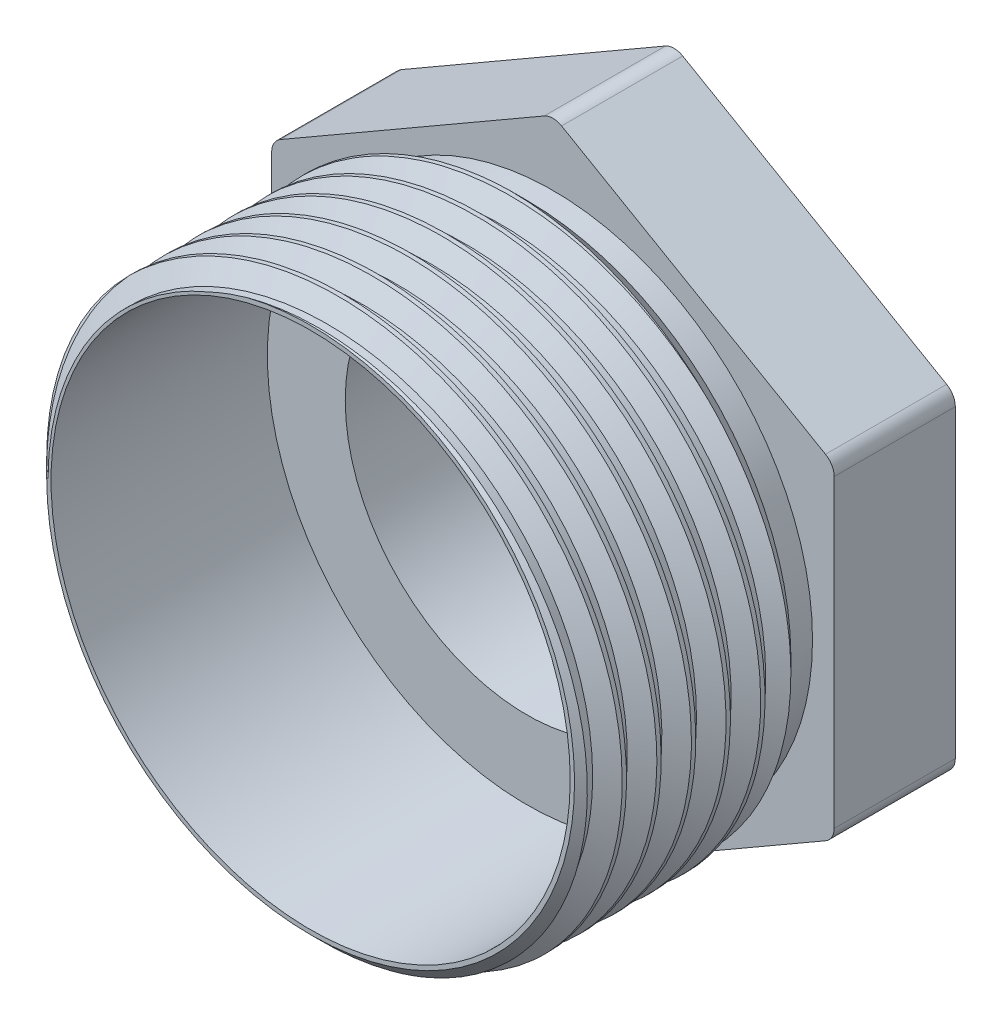
from build123d import *

# Parameters (mm, degrees)
SKETCH1_R           = 32.5
SKETCH1_R_2         = 30
SKETCH1_R_3         = 21
BOSS_EXTRUDE1_DEPTH = 14
SKETCH1_7_R         = 30
SKETCH1_7_R_2       = 21
BOSS_EXTRUDE5_DEPTH = 17
BOSS_EXTRUDE6_START = 17
SKETCH1_8_R         = 32.5
SKETCH1_8_R_2       = 30
BOSS_EXTRUDE6_DEPTH = 25
FILLET1_R           = 2
CHAMFER1_SIZE       = 2
THREAD1_PITCH       = 4


with BuildPart() as part:
    # Sketch1 → Boss-Extrude1 (new body)
    # profile 1 of 8: a face of its own
    with BuildSketch(Plane.XY):
        Circle(SKETCH1_R)
        Circle(SKETCH1_R_2, mode=Mode.SUBTRACT)
    # profile 2 of 8: a face of its own
    with BuildSketch(Plane.XY):
        Circle(SKETCH1_R_2)
        Circle(SKETCH1_R_3, mode=Mode.SUBTRACT)
    # profile 3 of 8: a face of its own
    with BuildSketch(Plane.XY):
        with BuildLine():
            ThreePointArc((16.2500004, 28.145825392), (28.145825739, 16.2499998), (32.5, 0))
            Line((32.5, 0), (32.5, 18.763883749))
            Line((32.5, 18.763883749), (16.2500004, 28.145825392))
        make_face()
    # profile 4 of 8: a face of its own
    with BuildSketch(Plane.XY):
        with BuildLine():
            Line((16.2500003, -28.14582545), (32.5, -18.763883749))
            Line((32.5, -18.763883749), (32.5, 0))
            ThreePointArc((32.5, 0), (28.14582571, -16.24999985), (16.2500003, -28.14582545))
        make_face()
    # profile 5 of 8: a face of its own
    with BuildSketch(Plane.XY):
        with BuildLine():
            ThreePointArc((-16.2500003, 28.14582545), (5.8e-08, 32.5), (16.2500004, 28.145825392))
            Line((16.2500004, 28.145825392), (0, 37.527767497))
            Line((0, 37.527767497), (-16.2500003, 28.14582545))
        make_face()
    # profile 6 of 8: a face of its own
    with BuildSketch(Plane.XY):
        with BuildLine():
            ThreePointArc((-32.5, 3e-08), (-28.145825702, 16.249999863), (-16.2500003, 28.14582545))
            Line((-16.2500003, 28.14582545), (-32.5, 18.763883749))
            Line((-32.5, 18.763883749), (-32.5, 3e-08))
        make_face()
    # profile 7 of 8: a face of its own
    with BuildSketch(Plane.XY):
        with BuildLine():
            Line((-32.5, -18.763883749), (-16.249999334, -28.145826007))
            ThreePointArc((-16.249999334, -28.145826007), (-28.145825438, -16.25000032), (-32.5, 3e-08))
            Line((-32.5, 3e-08), (-32.5, -18.763883749))
        make_face()
    # profile 8 of 8: a face of its own
    with BuildSketch(Plane.XY):
        with BuildLine():
            Line((0, -37.527767497), (16.2500003, -28.14582545))
            ThreePointArc((16.2500003, -28.14582545), (5.58e-07, -32.5), (-16.249999334, -28.145826007))
            Line((-16.249999334, -28.145826007), (0, -37.527767497))
        make_face()
    extrude(amount=BOSS_EXTRUDE1_DEPTH)

    # Sketch1<7> → Boss-Extrude5 (add)
    with BuildSketch(Plane.XY):
        Circle(SKETCH1_7_R)
        Circle(SKETCH1_7_R_2, mode=Mode.SUBTRACT)
    extrude(amount=BOSS_EXTRUDE5_DEPTH)

    # Fillet1
    fillet1_edges = [part.edges().sort_by_distance(p)[0] for p in [
        (0, -37.527767497, 7),
        (-32.5, -18.763883749, 7),
        (-32.5, 18.763883749, 7),
        (0, 37.527767497, 7),
        (32.5, 18.763883749, 7),
        (32.5, -18.763883749, 7),
    ]]
    fillet(fillet1_edges, radius=FILLET1_R)


with BuildPart() as body_2:
    # Sketch1<8> → Boss-Extrude6 (new body)
    with BuildSketch(Plane.XY.offset(BOSS_EXTRUDE6_START)):
        Circle(SKETCH1_8_R)
        Circle(SKETCH1_8_R_2, mode=Mode.SUBTRACT)
    extrude(amount=BOSS_EXTRUDE6_DEPTH)

    # Chamfer1
    chamfer1_edges = [body_2.edges().sort_by_distance(p)[0] for p in [
        (-32.5, 0, 17),
        (-32.5, 0, 42),
    ]]
    chamfer(chamfer1_edges, length=CHAMFER1_SIZE)

    # Thread1: the profile of Thread Profile3 profile screwed along a right-hand helix of 6.25 turns, 12 arcs to a turn; built about Z, then put on its axis
    thread1_z = Axis((0, 0, 0), (0, 0, 1))
    thread1_corners = [(32.5003, 0, -0.000173205), (32.5003, 0, 3.500173194), (30.3349365, 0, 2.249999995), (30.3349365, 0, 1.249999995)]
    with BuildLine(mode=Mode.PRIVATE) as thread1_profile:
        Line(thread1_corners[0], thread1_corners[1])
        Line(thread1_corners[1], thread1_corners[2])
        Line(thread1_corners[2], thread1_corners[3])
        Line(thread1_corners[3], thread1_corners[0])
    thread1_cap = Face(thread1_profile.wire())
    thread1_turn_angles = [0, 15, 30, 45, 60, 75, 90, 105, 120, 135, 150, 165, 180, 195, 210, 225, 240, 255, 270, 285, 300, 315, 330, 345, 360]
    thread1_turn_weights = [1, 0.9659258262890683, 1, 0.9659258262890683, 1, 0.9659258262890683, 1, 0.9659258262890683, 1, 0.9659258262890683, 1, 0.9659258262890683, 1, 0.9659258262890683, 1, 0.9659258262890683, 1, 0.9659258262890683, 1, 0.9659258262890683, 1, 0.9659258262890683, 1, 0.9659258262890683, 1]
    thread1_turn_rails = [Edge.make_bspline([Vector(p[0], p[1], 0).rotate(thread1_z, thread1_turn_angles[k]) / thread1_turn_weights[k] + Vector(0, 0, p[2] + THREAD1_PITCH * thread1_turn_angles[k] / 360) for k in range(25)], [0, 0, 0, 1, 1, 2, 2, 3, 3, 4, 4, 5, 5, 6, 6, 7, 7, 8, 8, 9, 9, 10, 10, 11, 11, 12, 12, 12], 2, thread1_turn_weights) for p in thread1_corners]
    thread1_turn_sides = [Face.make_surface_from_curves(thread1_turn_rails[p[0]], thread1_turn_rails[p[1]]) for p in [(0, 1), (1, 2), (2, 3), (3, 0)]]
    thread1_last_angles = [2160, 2175, 2190, 2205, 2220, 2235, 2250]
    thread1_last_weights = [1, 0.9659258262890683, 1, 0.9659258262890683, 1, 0.9659258262890734, 1]
    thread1_last_rails = [Edge.make_bspline([Vector(p[0], p[1], 0).rotate(thread1_z, thread1_last_angles[k]) / thread1_last_weights[k] + Vector(0, 0, p[2] + THREAD1_PITCH * thread1_last_angles[k] / 360) for k in range(7)], [0, 0, 0, 1, 1, 2, 2, 3, 3, 3], 2, thread1_last_weights) for p in thread1_corners]
    thread1_last_sides = [Face.make_surface_from_curves(thread1_last_rails[p[0]], thread1_last_rails[p[1]]) for p in [(0, 1), (1, 2), (2, 3), (3, 0)]]
    thread1 = Plane(origin=(0, 0, 44), x_dir=(-1, 0, 0), z_dir=(0, 0, -1)) * Solid(Shell([*[p.moved(Location((0, 0, THREAD1_PITCH * i))) for i in range(6) for p in thread1_turn_sides], *thread1_last_sides, thread1_cap, thread1_cap.rotate(thread1_z, 2250).moved(Location((0, 0, THREAD1_PITCH * 2250 / 360)))]))
    add(thread1, mode=Mode.SUBTRACT)


solid = Compound([part.part, body_2.part])
